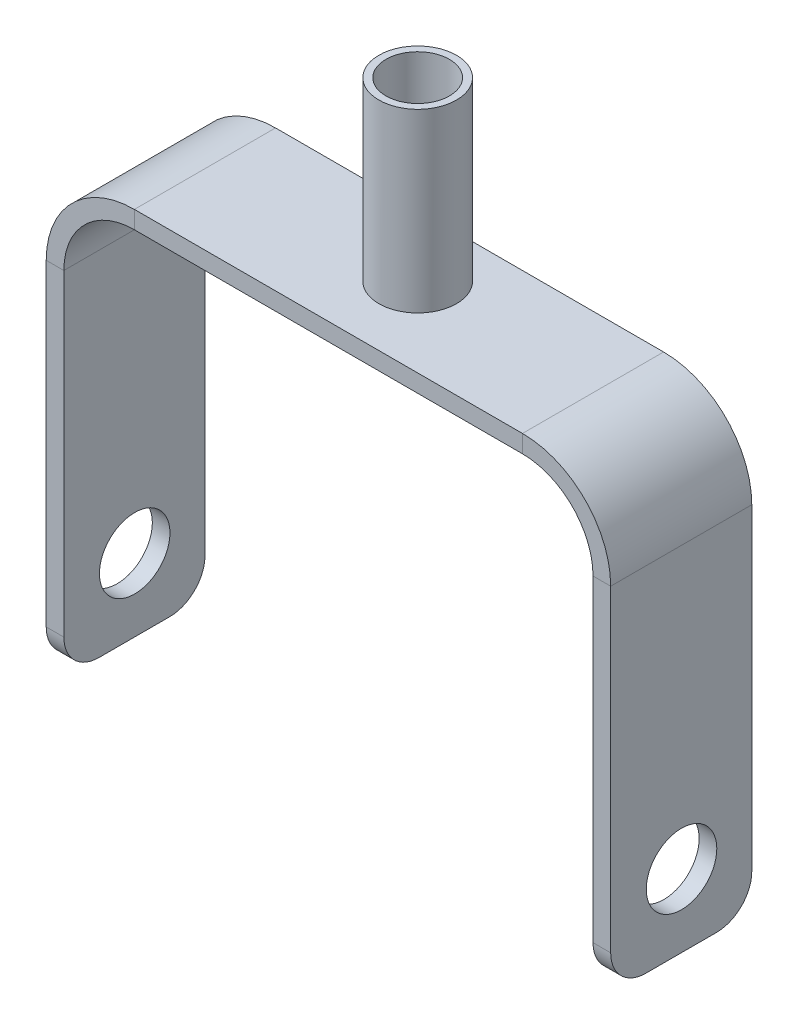
from build123d import *

# Parameters (mm, degrees)
BASE_FLANGE1_DEPTH  = 40
FILLET1_R           = 10
SKETCH3_R           = 10
CUT_EXTRUDE1_DEPTH  = 207.942020866
SKETCH4_R           = 11
SKETCH4_R_2         = 9
BOSS_EXTRUDE1_DEPTH = 50


# Sheet-metal steps are written as plain solids
with BuildPart() as part:
    # Sketch1 → Base-Flange1 (new body)
    with BuildSketch(Plane.XY):
        with BuildLine():
            Line((0, 0), (0, 100))
            ThreePointArc((0, 100), (5.857864376, 114.142135624), (20, 120))
            Line((20, 120), (130, 120))
            ThreePointArc((130, 120), (144.142135624, 114.142135624), (150, 100))
            Line((150, 100), (150, 0))
            Line((150, 0), (155, 0))
            Line((155, 0), (155, 100))
            ThreePointArc((155, 100), (147.67766953, 117.67766953), (130, 125))
            Line((130, 125), (20, 125))
            ThreePointArc((20, 125), (2.32233047, 117.67766953), (-5, 100))
            Line((-5, 100), (-5, 0))
            Line((-5, 0), (0, 0))
        make_face()
    extrude(amount=BASE_FLANGE1_DEPTH)

    # Fillet1
    fillet1_edges = [part.edges().sort_by_distance(p)[0] for p in [
        (152.5, 0, 0),
        (-2.5, 0, 0),
        (152.5, 0, 40),
        (-2.5, 0, 40),
    ]]
    fillet(fillet1_edges, radius=FILLET1_R)

    # Sketch3 → Cut-Extrude1 (cut, through all)
    with BuildSketch(Plane(origin=(155, 0, 0), x_dir=(0, 0, -1), z_dir=(1, 0, 0))):
        with Locations((-19.918118103, 20.545243048)):
            Circle(SKETCH3_R)
    extrude(amount=-CUT_EXTRUDE1_DEPTH, mode=Mode.SUBTRACT)

    # Sketch4 → Boss-Extrude1 (add)
    with BuildSketch(Plane(origin=(0, 125, 0), x_dir=(1, 0, 0), z_dir=(0, 1, 0))):
        with Locations(Location((77.803452919, -17.50804185, 0), (0, 0, 90))):
            Circle(SKETCH4_R)
        with Locations(Location((77.803452919, -17.50804185, 0), (0, 0, 270))):
            Circle(SKETCH4_R_2, mode=Mode.SUBTRACT)
    extrude(amount=BOSS_EXTRUDE1_DEPTH)


solid = part.part
